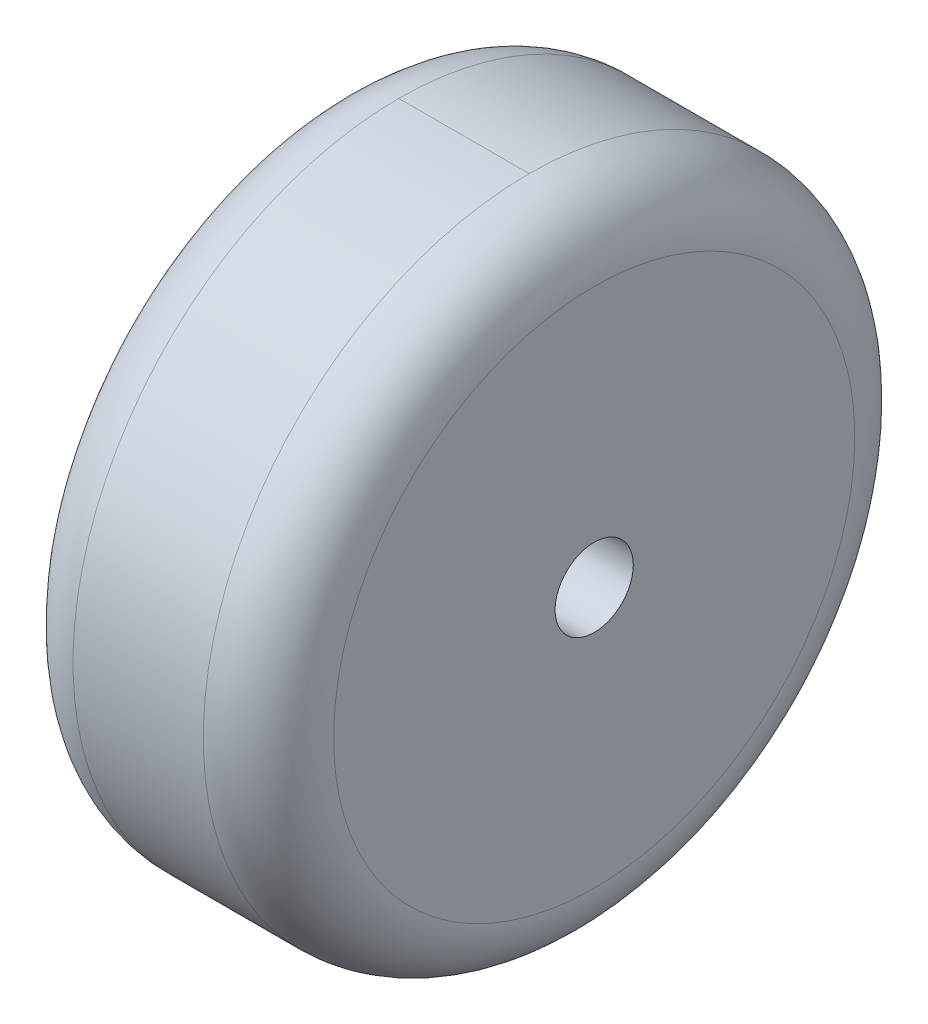
from build123d import *

# Parameters (mm, degrees)
SKETCH5_R      = 2
EXTRUDE4_DEPTH = 100
SKETCH6_R      = 3
EXTRUDE5_DEPTH = 100


with BuildPart() as part:
    # Fillet4: read off the stored shape, not the designer's step
    # Fillet4 outline → Fillet4 (revolve)
    with BuildSketch(Plane(origin=(0, -52.981969609, 284.712869435), x_dir=(0, 1, 0), z_dir=(0, 0, -1))):
        with BuildLine():
            Line((25, -5), (25, 5))
            ThreePointArc((25, 5), (23.535533906, 8.535533906), (20, 10))
            Line((20, 10), (0, 10))
            Line((0, 10), (0, -10))
            Line((0, -10), (20, -10))
            ThreePointArc((20, -10), (23.535533906, -8.535533906), (25, -5))
        make_face()
    revolve(axis=Axis((0, -52.981969609, 284.712869435), (1, 0, 0)))

    # Sketch5 → Extrude4 (cut)
    with BuildSketch(Plane(origin=(10, 0, 0), x_dir=(0, 0, -1), z_dir=(1, 0, 0))):
        with Locations((-284.712869435, -52.981969609)):
            Circle(SKETCH5_R)
    extrude(amount=-EXTRUDE4_DEPTH, mode=Mode.SUBTRACT)

    # Sketch6 → Extrude5 (cut)
    with BuildSketch(Plane(origin=(10, 0, 0), x_dir=(0, 0, -1), z_dir=(1, 0, 0))):
        with Locations((-284.712869435, -52.981969609)):
            Circle(SKETCH6_R)
    extrude(amount=-EXTRUDE5_DEPTH, mode=Mode.SUBTRACT)


solid = part.part
